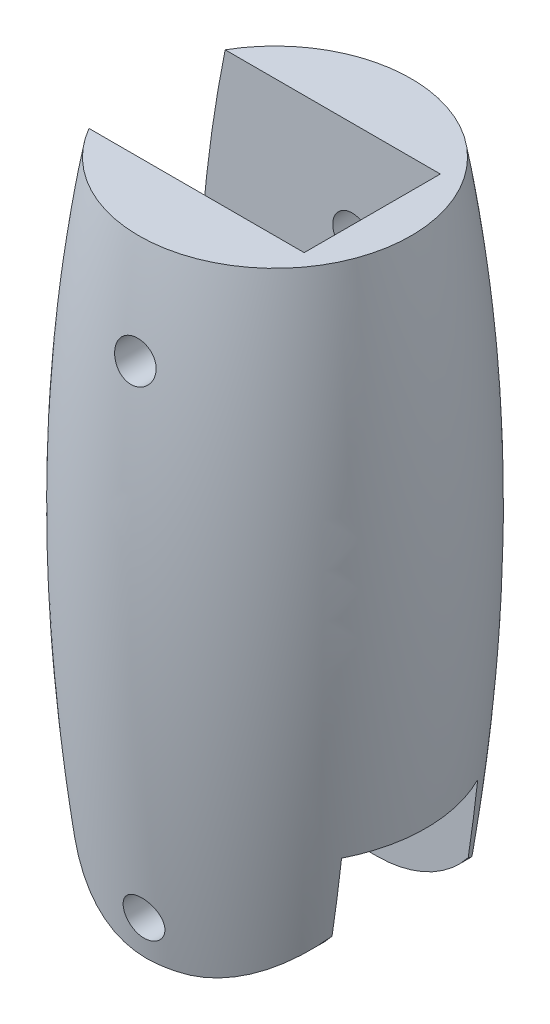
from build123d import *

# Parameters (mm, degrees)
CUT_EXTRUDE1_DEPTH      = 5
CUT_EXTRUDE1_DEPTH_BACK = 20.845866419
SKETCH2_W               = 7
SKETCH2_H               = 11
SKETCH2_H_2             = 13
CUT_EXTRUDE2_DEPTH      = 20.845866419
CUT_EXTRUDE2_DEPTH_BACK = 20.845866419
SKETCH3_R               = 1
CUT_EXTRUDE4_START      = 10
CUT_EXTRUDE4_DEPTH      = 20
SKETCH6_R               = 0.5
CUT_EXTRUDE5_DEPTH      = 25.059476613
SKETCH7_W               = 6.999992022
SKETCH7_H               = 6
CUT_EXTRUDE6_DEPTH      = 23.402723679


with BuildPart() as part:
    # Sketch1 → Revolve1 (revolve)
    with BuildSketch(Plane(origin=(0, 0, 0), x_dir=(0, 0, -1), z_dir=(1, 0, 0))):
        with BuildLine():
            Line((0, 16), (0, -16))
            Line((0, -16), (7, -16))
            add(Edge.make_bspline(
                [(7, 16), (9.604722665, 1.227883705), (7, -16)],
                knots=[0, 0, 0, 1, 1, 1], degree=2))
            Line((7, 16), (0, 16))
        make_face()
    revolve(axis=Axis((0, 16, 0), (0, -1, 0)))

    # Sketch2 → Cut-Extrude1 (cut, two sides: drawn at the far end of the back side and taken through both)
    with BuildSketch(Plane(origin=(0, 0, 0), x_dir=(0, 0, -1), z_dir=(1, 0, 0)).offset(-CUT_EXTRUDE1_DEPTH_BACK)):
        with Locations((0, 10.5)):
            Rectangle(SKETCH2_W, SKETCH2_H)
        with Locations((0, -9.5)):
            Rectangle(SKETCH2_W, SKETCH2_H_2)
    extrude(amount=CUT_EXTRUDE1_DEPTH + CUT_EXTRUDE1_DEPTH_BACK, mode=Mode.SUBTRACT)

    # Sketch3 → Cut-Extrude2 (cut, two sides: drawn at the far end of the back side and taken through both)
    with BuildSketch(Plane.XY.offset(-CUT_EXTRUDE2_DEPTH_BACK)):
        with Locations((0.468911087, 11)):
            Circle(SKETCH3_R)
        with Locations((0.468911087, -14)):
            Circle(SKETCH3_R)
    extrude(amount=CUT_EXTRUDE2_DEPTH + CUT_EXTRUDE2_DEPTH_BACK, mode=Mode.SUBTRACT)

    # Sketch5 → Cut-Extrude4 (cut)
    with BuildSketch(Plane.XY.offset(CUT_EXTRUDE4_START)):
        with BuildLine():
            Line((-6.062177826, -16), (0.910117982, -16))
            ThreePointArc((0.910117982, -16), (-4.45732236, -13.932165218), (-7.050017744, -8.797646043))
            add(Edge.make_bspline(
                [(-6.062177826, -16), (-6.437757064, -13.848691714), (-6.741485315, -11.68967719), (-7.000647249, -9.281372163), (-7.025777059, -9.039556784), (-7.050017744, -8.797646043)],
                knots=[0, 0, 0, 0, 0.5, 0.5, 0.555783836, 0.555783836, 0.555783836, 0.555783836], degree=3))
        make_face()
        with BuildLine():
            add(Edge.make_bspline(
                [(7, -16), (7.013595799, -15.909695487), (7.040767758, -15.729216903), (7.080753669, -15.458583276), (7.146297525, -15.008691454), (7.29056419, -13.986943062), (7.487309278, -12.468895785), (7.629352159, -11.218602021), (7.691486496, -10.632009884)],
                knots=[0, 0, 0, 0, 0.008523827, 0.017035341, 0.025534583, 0.05095908, 0.113348633, 0.168406234, 0.168406234, 0.168406234, 0.168406234], degree=3))
            ThreePointArc((7.691486496, -10.632009884), (5.737840967, -14.46049657), (1.724865718, -16))
            Line((1.724865718, -16), (7, -16))
        make_face()
    extrude(amount=-CUT_EXTRUDE4_DEPTH, mode=Mode.SUBTRACT)


with BuildPart() as cut_extrude4_kept_piece:
    # of the separate pieces the step leaves, the one the design keeps (cut_extrude4_pieces_kept)
    add(part.part.solids().sort_by_distance((0.910117982, -16, -6.940582487))[0])

    # Sketch6 → Cut-Extrude5 (cut, through all)
    with BuildSketch(Plane(origin=(0, 5, 0), x_dir=(1, 0, 0), z_dir=(0, 1, 0))):
        with Locations((4, 0)):
            Circle(SKETCH6_R)
        with Locations((-3, 0)):
            Circle(SKETCH6_R)
    extrude(amount=-CUT_EXTRUDE5_DEPTH, mode=Mode.SUBTRACT)

    # Sketch7 → Cut-Extrude6 (cut, through all)
    with BuildSketch(Plane.ZY.offset(-5)):
        with Locations((-3.989e-06, -13)):
            Rectangle(SKETCH7_W, SKETCH7_H)
    extrude(amount=-CUT_EXTRUDE6_DEPTH, mode=Mode.SUBTRACT)


solid = cut_extrude4_kept_piece.part
